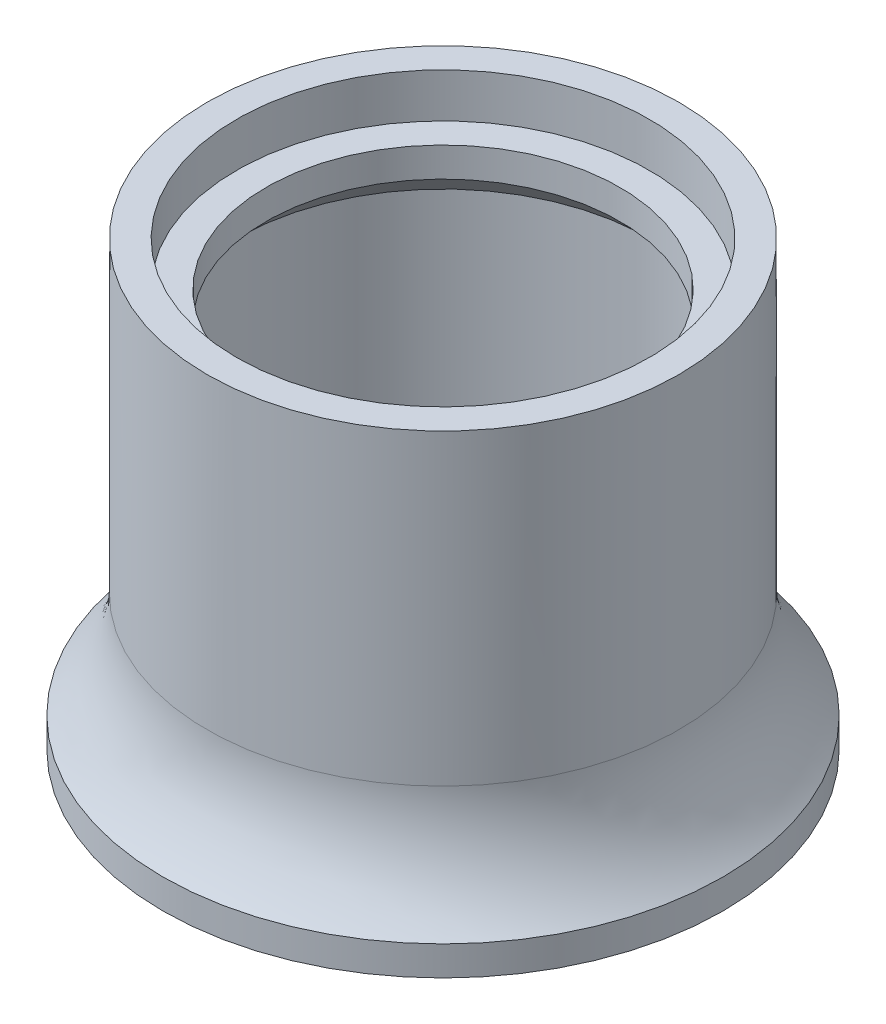
from build123d import *

# Parameters (mm, degrees)
SKETCH1_R           = 16
SKETCH1_R_2         = 14
BOSS_EXTRUDE1_DEPTH = 30
BOSS_EXTRUDE3_START = -2
SKETCH3_R           = 14
SKETCH3_R_2         = 12
BOSS_EXTRUDE3_DEPTH = 2
CHAMFER1_SIZE       = 2
BOSS_EXTRUDE4_START = 2
SKETCH4_R           = 19
SKETCH4_R_2         = 16
BOSS_EXTRUDE4_DEPTH = 2
FILLET2_R           = 10


# Some blends are built 0.0001 mm under size
with BuildPart() as part:
    # Sketch1 → Boss-Extrude1 (new body)
    with BuildSketch(Plane(origin=(0, 0, 0), x_dir=(1, 0, 0), z_dir=(0, 1, 0))):
        with Locations(Location((0, 0, 0), (0, 0, 270))):
            Circle(SKETCH1_R)
        with Locations(Location((0, 0, 0), (0, 0, 270))):
            Circle(SKETCH1_R_2, mode=Mode.SUBTRACT)
    extrude(amount=BOSS_EXTRUDE1_DEPTH)

    # Sketch3 → Boss-Extrude3 (add)
    with BuildSketch(Plane(origin=(0, 27, 0), x_dir=(1, 0, 0), z_dir=(0, 1, 0)).offset(BOSS_EXTRUDE3_START)):
        with Locations(Location((0, 0, 0), (0, 0, 270))):
            Circle(SKETCH3_R)
        with Locations(Location((0, 0, 0), (0, 0, 270))):
            Circle(SKETCH3_R_2, mode=Mode.SUBTRACT)
    extrude(amount=BOSS_EXTRUDE3_DEPTH)

    # Chamfer1
    chamfer1_edges = [part.edges().sort_by_distance(p)[0] for p in [
        (0, 25, -14),
    ]]
    chamfer(chamfer1_edges, length=CHAMFER1_SIZE - 0.0001)  # a hair under: the kernel refuses the full size

    # Sketch4 → Boss-Extrude4 (add)
    with BuildSketch(Plane(origin=(0, 2, 0), x_dir=(-1, 0, 0), z_dir=(0, -1, 0)).offset(BOSS_EXTRUDE4_START)):
        with Locations(Location((0, 0, 0), (0, 0, 270))):
            Circle(SKETCH4_R)
        with Locations(Location((0, 0, 0), (0, 0, 90))):
            Circle(SKETCH4_R_2, mode=Mode.SUBTRACT)
    extrude(amount=-BOSS_EXTRUDE4_DEPTH)

    # Fillet2
    # the kernel refuses this fillet: 10 mm, written as the material it adds along each edge
    with BuildSketch(Plane(origin=(0, 2, 0), x_dir=(0, 0, 1), z_dir=(1, 0, 0))) as fillet2_piece_1:
        with BuildLine():
            CenterArc((26, -7.141428429), FILLET2_R, 134.427004001, 45.572995999)
            Line((16, -7.141428429), (15.8, -7.141428429))
            Line((15.8, -7.141428429), (15.8, 0))
            Line((15.8, 0), (16, 0.2))
            ThreePointArc((16, 0.2), (17.5, 0.2), (18.86, 0.142828569))
            Line((18.86, 0.142828569), (19, 0))
        make_face()
    revolve(axis=Axis((0, 2, 0), (0, -1, 0)))


solid = part.part
